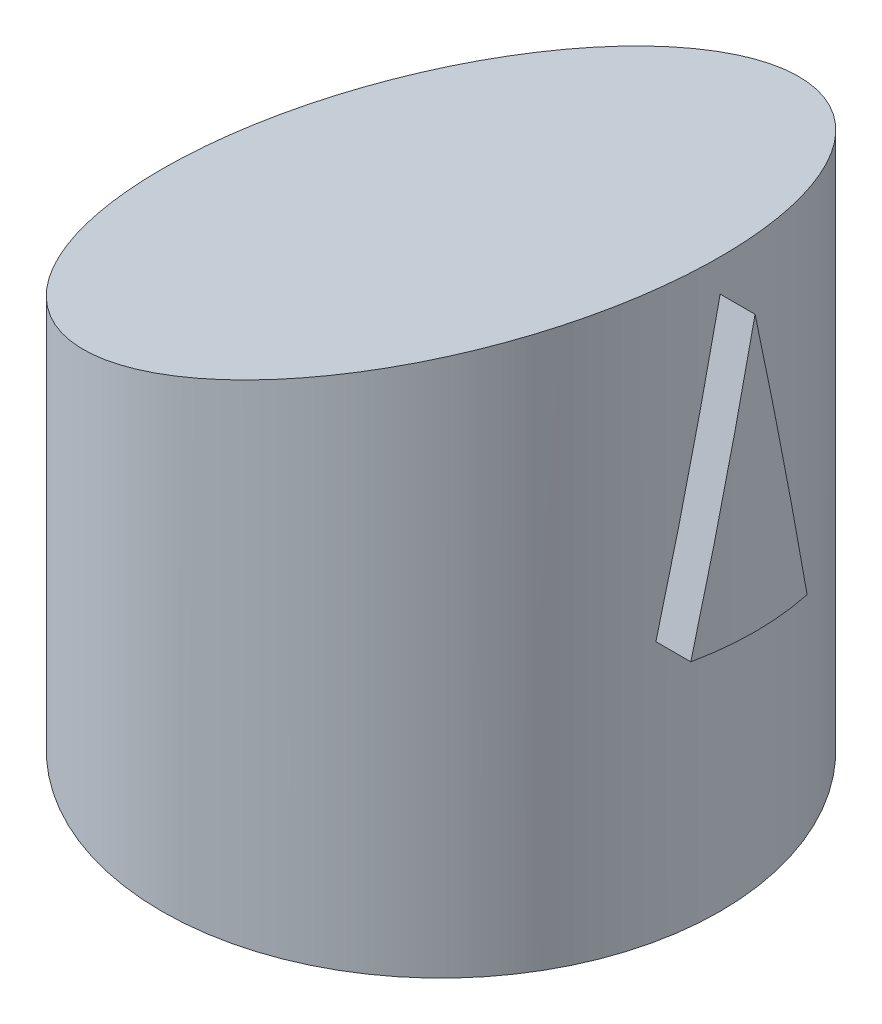
from build123d import *

# Parameters (mm, degrees)
SKETCH1_R                  = 24
SKETCH1_W                  = 5
SKETCH1_H                  = 3
BOSS_EXTRUDE1_DEPTH        = 6
BOSS_EXTRUDE4_OUTLINE_R    = 24
BOSS_EXTRUDE4_DEPTH        = 25.264714378
BOSS_EXTRUDE4_START        = 31.264714378
BOSS_EXTRUDE4_2_OUTLINE_R  = 24
BOSS_EXTRUDE4_2_DEPTH      = 17.470571244
BOSS_EXTRUDE4_START_2      = -55
BOSS_EXTRUDE4_3_OUTLINE_W  = 54
BOSS_EXTRUDE4_3_OUTLINE_H  = 50
BOSS_EXTRUDE4_3_DEPTH      = 17.412295169
BOSS_EXTRUDE5_REACH        = 64.39
BOSS_EXTRUDE5_START_RADIUS = 24
BOSS_EXTRUDE5_END_RADIUS   = 24


with BuildPart() as part:
    # Sketch1 → Boss-Extrude1 (new body)
    with BuildSketch(Plane(origin=(0, 0, 0), x_dir=(1, 0, 0), z_dir=(0, 1, 0))):
        with Locations(Location((0, 0, 0), (0, 0, 270))):
            Circle(SKETCH1_R)
        Rectangle(SKETCH1_W, SKETCH1_H, mode=Mode.SUBTRACT)
    extrude(amount=BOSS_EXTRUDE1_DEPTH)

    # Boss-Extrude4: read off the stored shape, not the designer's step
    # Boss-Extrude4 outline → Boss-Extrude4 (add)
    with BuildSketch(Plane(origin=(0, 6, 0), x_dir=(1, 0, 0), z_dir=(0, 1, 0))):
        Circle(BOSS_EXTRUDE4_OUTLINE_R)
    extrude(amount=BOSS_EXTRUDE4_DEPTH)

    # Boss-Extrude4 2 outline → Boss-Extrude4 2 (add)
    with BuildSketch(Plane(origin=(0, 0, 0), x_dir=(1, 0, 0), z_dir=(0, 1, 0)).offset(BOSS_EXTRUDE4_START)):
        Circle(BOSS_EXTRUDE4_2_OUTLINE_R)
    extrude(amount=BOSS_EXTRUDE4_2_DEPTH)

    # Boss-Extrude4 3 outline → Boss-Extrude4 3 (cut)
    with BuildSketch(Plane(origin=(0, 0, 0), x_dir=(0.9396926207859082, 0.3420201433256691, 0), z_dir=(0.3420201433256691, -0.9396926207859083, 0)).offset(BOSS_EXTRUDE4_START_2)):
        with Locations((14, 0)):
            Rectangle(BOSS_EXTRUDE4_3_OUTLINE_W, BOSS_EXTRUDE4_3_OUTLINE_H)
    extrude(amount=BOSS_EXTRUDE4_3_DEPTH, mode=Mode.SUBTRACT)

    # Boss-Extrude5: from a cylinder face, 64.39 long prism both ways, kept between that surface and its translate by the depth
    boss_extrude5_start = Plane(origin=(0, 30.19918, 0), z_dir=(0, -1, 0)) * Cylinder(BOSS_EXTRUDE5_START_RADIUS, 177.78, mode=Mode.PRIVATE)
    boss_extrude5_end = Plane(origin=(3, 30.19918, 0), z_dir=(0, -1, 0)) * Cylinder(BOSS_EXTRUDE5_END_RADIUS, 177.78, mode=Mode.PRIVATE)
    # Sketch5 → Boss-Extrude5 (add, from a surface)
    with BuildSketch(Plane(origin=(0, 0, 0), x_dir=(0, 0, -1), z_dir=(1, 0, 0)), mode=Mode.PRIVATE) as boss_extrude5_sk1:
        Polygon((0, 45.957345566), (-5, 22.320096474), (5, 22.320096474), align=None)
    boss_extrude5_tool1 = extrude(boss_extrude5_sk1.sketch, amount=BOSS_EXTRUDE5_REACH, both=True, mode=Mode.PRIVATE)
    add(((boss_extrude5_tool1 - boss_extrude5_start) & boss_extrude5_end).solids().sort_by_distance((25.236695, 30.19918, 0))[0])


solid = part.part
